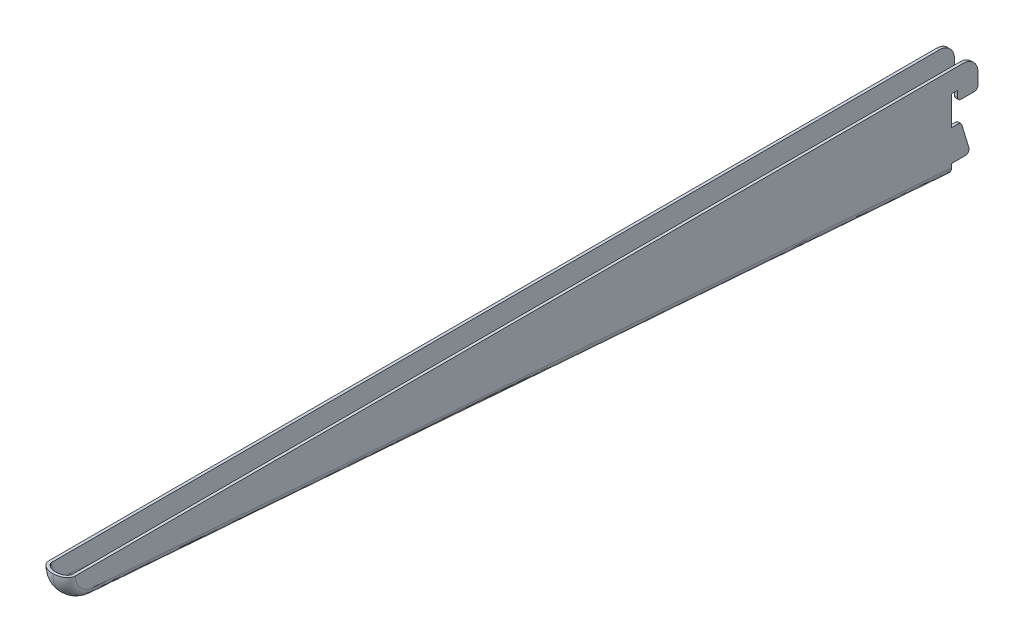
from build123d import *

# Parameters (mm, degrees)
BOSS_EXTRUDE1_DEPTH = 7
FILLET1_SIZE        = 7
FILLET1_SIZE_2      = 5
SHELL1_T            = -1.5
BOSS_EXTRUDE2_START = 5.5
BOSS_EXTRUDE2_DEPTH = 1.5
FILLET2_R           = 8
FILLET3_R           = 2


with BuildPart() as part:
    # Sketch1 → Boss-Extrude1 (new body)
    with BuildSketch(Plane(origin=(0, 0, 0), x_dir=(0, 0, -1), z_dir=(1, 0, 0))):
        with BuildLine():
            Line((0, 50), (-470, 50))
            ThreePointArc((-470, 50), (-466.005340673, 39.807724657), (-456.149003112, 35.044071682))
            Line((-456.149003112, 35.044071682), (0, 0))
            Line((0, 0), (0, 50))
        make_face()
    extrude(amount=BOSS_EXTRUDE1_DEPTH)

    # Fillet1
    # an asymmetric fillet: 7, 5 mm, written as the material it takes off along each edge
    with BuildSketch(Plane(origin=(7, 50, 455), x_dir=(0, 0.9196116258255719, 0.39282878922814246), z_dir=(0, 0.39282878922814246, -0.9196116258255719))) as fillet1_piece_1:
        with BuildLine():
            Bezier((15, -FILLET1_SIZE), (15, 0), (15 - FILLET1_SIZE_2, 0), weights=[1, 0.707106781, 1])
            Line((15 - FILLET1_SIZE_2, 0), (15, 0))
            Line((15, 0), (15, -FILLET1_SIZE))
        make_face()
    revolve(axis=Axis((7, 50, 455), (1, 0, 0)), revolution_arc=152.476198182, mode=Mode.SUBTRACT)
    with BuildSketch(Plane(origin=(7, 35.044071682, 456.149003112), x_dir=(-1, 0, 0), z_dir=(0, -0.07660020745684637, -0.9970618878573025))) as fillet1_piece_2:
        with BuildLine():
            Bezier((FILLET1_SIZE, 0), (0, 0), (0, FILLET1_SIZE_2), weights=[1, 0.707106781, 1])
            Line((0, FILLET1_SIZE_2), (0, 0))
            Line((0, 0), (FILLET1_SIZE, 0))
        make_face()
    extrude(amount=474.993169348, mode=Mode.SUBTRACT)

    # Shell1
    shell1_openings = [part.faces().sort_by_distance(p)[0] for p in [
        (3.495569925, 50, 234.464823017),
        (0, 32.308714592, 189.987101706),
        (3.457404662, 25.52528288, 0),
    ]]
    offset(amount=SHELL1_T, openings=shell1_openings, kind=Kind.INTERSECTION)

    # Sketch1<4> → Boss-Extrude2 (add)
    with BuildSketch(Plane(origin=(0, 0, 0), x_dir=(0, 0, -1), z_dir=(1, 0, 0)).offset(BOSS_EXTRUDE2_START)):
        Polygon((0, 23.5), (0, 7), (10, 7), (5, 23.5), align=None)
        Polygon((0, 50), (0, 39), (3, 39), (3, 34), (14, 34), (14, 50), align=None)
    extrude(amount=BOSS_EXTRUDE2_DEPTH)

    # Fillet2
    fillet2_edges = [part.edges().sort_by_distance(p)[0] for p in [
        (6.25, 50, -14),
    ]]
    fillet(fillet2_edges, radius=FILLET2_R)

    # Fillet3
    fillet3_edges = [part.edges().sort_by_distance(p)[0] for p in [
        (6.25, 23.5, -5),
        (6.25, 7, -10),
        (6.25, 34, -14),
        (6.25, 34, -3),
    ]]
    fillet(fillet3_edges, radius=FILLET3_R)

    # Mirror5: part across plane


with BuildPart() as part_1:
    add(part.part)
    add(part.part.mirror(Plane(origin=(0, 0, 0), x_dir=(0, 0, 1), z_dir=(1, 0, 0))))


solid = part_1.part
